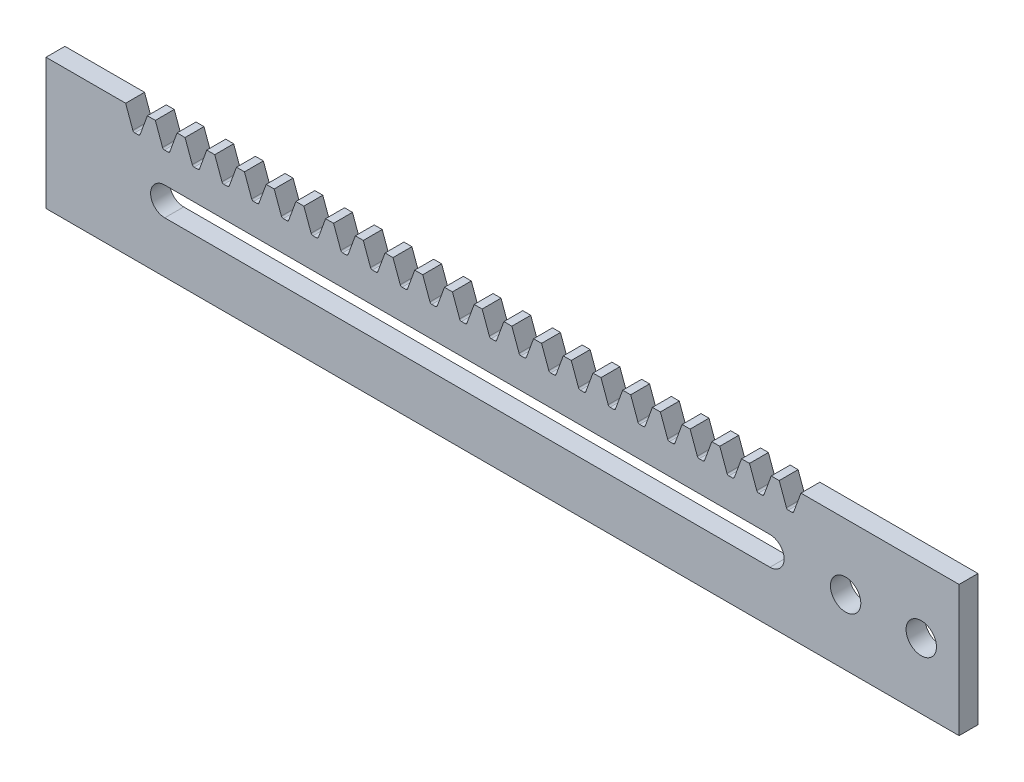
from build123d import *

# Parameters (mm, degrees)
SKETCH1_W              = 609.6
SKETCH1_H              = 19.05
BOSS_EXTRUDE1_DEPTH    = 9.525
CUT_EXTRUDE1_DEPTH     = 19.05
FILLET3_R              = 0.320981709
LPATTERN4_START        = -9.525
LPATTERN4_DEPTH        = 19.05
SKETCH3_W              = 38.983944938
SKETCH3_H              = 30.803159919
CUT_EXTRUDE2_DEPTH     = 381
SKETCH4_W              = 254.285673571
SKETCH4_H              = 51.900357991
CUT_EXTRUDE3_DEPTH     = 15.875
SKETCH5_W              = 228.6
SKETCH5_H              = 3.175
BOSS_EXTRUDE2_DEPTH    = 2.9464
SKETCH8_W              = 113.410729753
SKETCH8_H              = 25.4
CUT_EXTRUDE4_DEPTH     = 306.071559545
SKETCH9_W              = 3.175
SKETCH9_H              = 21.9964
BOSS_EXTRUDE3_DEPTH    = 12.7
SKETCH10_W             = 3.175
SKETCH10_H             = 21.9964
BOSS_EXTRUDE4_DEPTH    = 25.4
F_10_CLEARANCE_HOLE1_D = 5.1054
CUT_EXTRUDE5_DEPTH     = 12.7


with BuildPart() as part:
    # Sketch1 → Boss-Extrude1 (new, symmetric)
    with BuildSketch(Plane.XY):
        Rectangle(SKETCH1_W, SKETCH1_H)
    extrude(amount=BOSS_EXTRUDE1_DEPTH, both=True)

    # Sketch2 → Cut-Extrude1 (cut)
    with BuildSketch(Plane.XY.offset(9.525)):
        Polygon((-303.461960494, 9.525), (-302.172304763, 5.9817), (-301.102365731, 5.9817), (-299.81271, 9.525), align=None)
    extrude(amount=-CUT_EXTRUDE1_DEPTH, mode=Mode.SUBTRACT)

    # Fillet3
    fillet3_edges = [part.edges().sort_by_distance(p)[0] for p in [
        (-301.102365731, 5.9817, 0),
        (-302.172304763, 5.9817, 0),
    ]]
    fillet(fillet3_edges, radius=FILLET3_R)

    # LPattern4: read off the stored shape, not the designer's step
    # LPattern4 outline → LPattern4 (cut)
    with BuildSketch(Plane.XY.offset(LPATTERN4_START)):
        with BuildLine():
            ThreePointArc((-297.261885094, 6.192899499), (-297.144368495, 6.039748886), (-296.96026095, 5.9817))
            Line((-296.96026095, 5.9817), (-296.339829544, 5.9817))
            ThreePointArc((-296.339829544, 5.9817), (-296.155721999, 6.039748886), (-296.0382054, 6.192899499))
            Line((-296.0382054, 6.192899499), (-294.82542, 9.525))
            Line((-294.82542, 9.525), (-298.474670494, 9.525))
            Line((-298.474670494, 9.525), (-297.261885094, 6.192899499))
        make_face()
        with BuildLine():
            Line((303.64938, 9.525), (300.000129506, 9.525))
            Line((300.000129506, 9.525), (301.212914906, 6.192899499))
            ThreePointArc((301.212914906, 6.192899499), (301.330431505, 6.039748886), (301.51453905, 5.9817))
            Line((301.51453905, 5.9817), (302.134970456, 5.9817))
            ThreePointArc((302.134970456, 5.9817), (302.319078001, 6.039748886), (302.4365946, 6.192899499))
            Line((302.4365946, 6.192899499), (303.64938, 9.525))
        make_face()
        with BuildLine():
            Line((298.66209, 9.525), (295.012839506, 9.525))
            Line((295.012839506, 9.525), (296.225624906, 6.192899499))
            ThreePointArc((296.225624906, 6.192899499), (296.343141505, 6.039748886), (296.52724905, 5.9817))
            Line((296.52724905, 5.9817), (297.147680456, 5.9817))
            ThreePointArc((297.147680456, 5.9817), (297.331788001, 6.039748886), (297.4493046, 6.192899499))
            Line((297.4493046, 6.192899499), (298.66209, 9.525))
        make_face()
        with BuildLine():
            Line((293.6748, 9.525), (290.025549506, 9.525))
            Line((290.025549506, 9.525), (291.238334906, 6.192899499))
            ThreePointArc((291.238334906, 6.192899499), (291.355851505, 6.039748886), (291.53995905, 5.9817))
            Line((291.53995905, 5.9817), (292.160390456, 5.9817))
            ThreePointArc((292.160390456, 5.9817), (292.344498001, 6.039748886), (292.4620146, 6.192899499))
            Line((292.4620146, 6.192899499), (293.6748, 9.525))
        make_face()
        with BuildLine():
            Line((288.68751, 9.525), (285.038259506, 9.525))
            Line((285.038259506, 9.525), (286.251044906, 6.192899499))
            ThreePointArc((286.251044906, 6.192899499), (286.368561505, 6.039748886), (286.55266905, 5.9817))
            Line((286.55266905, 5.9817), (287.173100456, 5.9817))
            ThreePointArc((287.173100456, 5.9817), (287.357208001, 6.039748886), (287.4747246, 6.192899499))
            Line((287.4747246, 6.192899499), (288.68751, 9.525))
        make_face()
        with BuildLine():
            Line((283.70022, 9.525), (280.050969506, 9.525))
            Line((280.050969506, 9.525), (281.263754906, 6.192899499))
            ThreePointArc((281.263754906, 6.192899499), (281.381271505, 6.039748886), (281.56537905, 5.9817))
            Line((281.56537905, 5.9817), (282.185810456, 5.9817))
            ThreePointArc((282.185810456, 5.9817), (282.369918001, 6.039748886), (282.4874346, 6.192899499))
            Line((282.4874346, 6.192899499), (283.70022, 9.525))
        make_face()
        with BuildLine():
            Line((278.71293, 9.525), (275.063679506, 9.525))
            Line((275.063679506, 9.525), (276.276464906, 6.192899499))
            ThreePointArc((276.276464906, 6.192899499), (276.393981505, 6.039748886), (276.57808905, 5.9817))
            Line((276.57808905, 5.9817), (277.198520456, 5.9817))
            ThreePointArc((277.198520456, 5.9817), (277.382628001, 6.039748886), (277.5001446, 6.192899499))
            Line((277.5001446, 6.192899499), (278.71293, 9.525))
        make_face()
        with BuildLine():
            Line((273.72564, 9.525), (270.076389506, 9.525))
            Line((270.076389506, 9.525), (271.289174906, 6.192899499))
            ThreePointArc((271.289174906, 6.192899499), (271.406691505, 6.039748886), (271.59079905, 5.9817))
            Line((271.59079905, 5.9817), (272.211230456, 5.9817))
            ThreePointArc((272.211230456, 5.9817), (272.395338001, 6.039748886), (272.5128546, 6.192899499))
            Line((272.5128546, 6.192899499), (273.72564, 9.525))
        make_face()
        with BuildLine():
            Line((268.73835, 9.525), (265.089099506, 9.525))
            Line((265.089099506, 9.525), (266.301884906, 6.192899499))
            ThreePointArc((266.301884906, 6.192899499), (266.419401505, 6.039748886), (266.60350905, 5.9817))
            Line((266.60350905, 5.9817), (267.223940456, 5.9817))
            ThreePointArc((267.223940456, 5.9817), (267.408048001, 6.039748886), (267.5255646, 6.192899499))
            Line((267.5255646, 6.192899499), (268.73835, 9.525))
        make_face()
        with BuildLine():
            Line((263.75106, 9.525), (260.101809506, 9.525))
            Line((260.101809506, 9.525), (261.314594906, 6.192899499))
            ThreePointArc((261.314594906, 6.192899499), (261.432111505, 6.039748886), (261.61621905, 5.9817))
            Line((261.61621905, 5.9817), (262.236650456, 5.9817))
            ThreePointArc((262.236650456, 5.9817), (262.420758001, 6.039748886), (262.5382746, 6.192899499))
            Line((262.5382746, 6.192899499), (263.75106, 9.525))
        make_face()
        with BuildLine():
            Line((258.76377, 9.525), (255.114519506, 9.525))
            Line((255.114519506, 9.525), (256.327304906, 6.192899499))
            ThreePointArc((256.327304906, 6.192899499), (256.444821505, 6.039748886), (256.62892905, 5.9817))
            Line((256.62892905, 5.9817), (257.249360456, 5.9817))
            ThreePointArc((257.249360456, 5.9817), (257.433468001, 6.039748886), (257.5509846, 6.192899499))
            Line((257.5509846, 6.192899499), (258.76377, 9.525))
        make_face()
        with BuildLine():
            Line((253.77648, 9.525), (250.127229506, 9.525))
            Line((250.127229506, 9.525), (251.340014906, 6.192899499))
            ThreePointArc((251.340014906, 6.192899499), (251.457531505, 6.039748886), (251.64163905, 5.9817))
            Line((251.64163905, 5.9817), (252.262070456, 5.9817))
            ThreePointArc((252.262070456, 5.9817), (252.446178001, 6.039748886), (252.5636946, 6.192899499))
            Line((252.5636946, 6.192899499), (253.77648, 9.525))
        make_face()
        with BuildLine():
            Line((248.78919, 9.525), (245.139939506, 9.525))
            Line((245.139939506, 9.525), (246.352724906, 6.192899499))
            ThreePointArc((246.352724906, 6.192899499), (246.470241505, 6.039748886), (246.65434905, 5.9817))
            Line((246.65434905, 5.9817), (247.274780456, 5.9817))
            ThreePointArc((247.274780456, 5.9817), (247.458888001, 6.039748886), (247.5764046, 6.192899499))
            Line((247.5764046, 6.192899499), (248.78919, 9.525))
        make_face()
        with BuildLine():
            Line((243.8019, 9.525), (240.152649506, 9.525))
            Line((240.152649506, 9.525), (241.365434906, 6.192899499))
            ThreePointArc((241.365434906, 6.192899499), (241.482951505, 6.039748886), (241.66705905, 5.9817))
            Line((241.66705905, 5.9817), (242.287490456, 5.9817))
            ThreePointArc((242.287490456, 5.9817), (242.471598001, 6.039748886), (242.5891146, 6.192899499))
            Line((242.5891146, 6.192899499), (243.8019, 9.525))
        make_face()
        with BuildLine():
            Line((238.81461, 9.525), (235.165359506, 9.525))
            Line((235.165359506, 9.525), (236.378144906, 6.192899499))
            ThreePointArc((236.378144906, 6.192899499), (236.495661505, 6.039748886), (236.67976905, 5.9817))
            Line((236.67976905, 5.9817), (237.300200456, 5.9817))
            ThreePointArc((237.300200456, 5.9817), (237.484308001, 6.039748886), (237.6018246, 6.192899499))
            Line((237.6018246, 6.192899499), (238.81461, 9.525))
        make_face()
        with BuildLine():
            Line((233.82732, 9.525), (230.178069506, 9.525))
            Line((230.178069506, 9.525), (231.390854906, 6.192899499))
            ThreePointArc((231.390854906, 6.192899499), (231.508371505, 6.039748886), (231.69247905, 5.9817))
            Line((231.69247905, 5.9817), (232.312910456, 5.9817))
            ThreePointArc((232.312910456, 5.9817), (232.497018001, 6.039748886), (232.6145346, 6.192899499))
            Line((232.6145346, 6.192899499), (233.82732, 9.525))
        make_face()
        with BuildLine():
            Line((228.84003, 9.525), (225.190779506, 9.525))
            Line((225.190779506, 9.525), (226.403564906, 6.192899499))
            ThreePointArc((226.403564906, 6.192899499), (226.521081505, 6.039748886), (226.70518905, 5.9817))
            Line((226.70518905, 5.9817), (227.325620456, 5.9817))
            ThreePointArc((227.325620456, 5.9817), (227.509728001, 6.039748886), (227.6272446, 6.192899499))
            Line((227.6272446, 6.192899499), (228.84003, 9.525))
        make_face()
        with BuildLine():
            Line((223.85274, 9.525), (220.203489506, 9.525))
            Line((220.203489506, 9.525), (221.416274906, 6.192899499))
            ThreePointArc((221.416274906, 6.192899499), (221.533791505, 6.039748886), (221.71789905, 5.9817))
            Line((221.71789905, 5.9817), (222.338330456, 5.9817))
            ThreePointArc((222.338330456, 5.9817), (222.522438001, 6.039748886), (222.6399546, 6.192899499))
            Line((222.6399546, 6.192899499), (223.85274, 9.525))
        make_face()
        with BuildLine():
            Line((218.86545, 9.525), (215.216199506, 9.525))
            Line((215.216199506, 9.525), (216.428984906, 6.192899499))
            ThreePointArc((216.428984906, 6.192899499), (216.546501505, 6.039748886), (216.73060905, 5.9817))
            Line((216.73060905, 5.9817), (217.351040456, 5.9817))
            ThreePointArc((217.351040456, 5.9817), (217.535148001, 6.039748886), (217.6526646, 6.192899499))
            Line((217.6526646, 6.192899499), (218.86545, 9.525))
        make_face()
        with BuildLine():
            Line((213.87816, 9.525), (210.228909506, 9.525))
            Line((210.228909506, 9.525), (211.441694906, 6.192899499))
            ThreePointArc((211.441694906, 6.192899499), (211.559211505, 6.039748886), (211.74331905, 5.9817))
            Line((211.74331905, 5.9817), (212.363750456, 5.9817))
            ThreePointArc((212.363750456, 5.9817), (212.547858001, 6.039748886), (212.6653746, 6.192899499))
            Line((212.6653746, 6.192899499), (213.87816, 9.525))
        make_face()
        with BuildLine():
            Line((208.89087, 9.525), (205.241619506, 9.525))
            Line((205.241619506, 9.525), (206.454404906, 6.192899499))
            ThreePointArc((206.454404906, 6.192899499), (206.571921505, 6.039748886), (206.75602905, 5.9817))
            Line((206.75602905, 5.9817), (207.376460456, 5.9817))
            ThreePointArc((207.376460456, 5.9817), (207.560568001, 6.039748886), (207.6780846, 6.192899499))
            Line((207.6780846, 6.192899499), (208.89087, 9.525))
        make_face()
        with BuildLine():
            Line((203.90358, 9.525), (200.254329506, 9.525))
            Line((200.254329506, 9.525), (201.467114906, 6.192899499))
            ThreePointArc((201.467114906, 6.192899499), (201.584631505, 6.039748886), (201.76873905, 5.9817))
            Line((201.76873905, 5.9817), (202.389170456, 5.9817))
            ThreePointArc((202.389170456, 5.9817), (202.573278001, 6.039748886), (202.6907946, 6.192899499))
            Line((202.6907946, 6.192899499), (203.90358, 9.525))
        make_face()
        with BuildLine():
            Line((198.91629, 9.525), (195.267039506, 9.525))
            Line((195.267039506, 9.525), (196.479824906, 6.192899499))
            ThreePointArc((196.479824906, 6.192899499), (196.597341505, 6.039748886), (196.78144905, 5.9817))
            Line((196.78144905, 5.9817), (197.401880456, 5.9817))
            ThreePointArc((197.401880456, 5.9817), (197.585988001, 6.039748886), (197.7035046, 6.192899499))
            Line((197.7035046, 6.192899499), (198.91629, 9.525))
        make_face()
        with BuildLine():
            Line((193.929, 9.525), (190.279749506, 9.525))
            Line((190.279749506, 9.525), (191.492534906, 6.192899499))
            ThreePointArc((191.492534906, 6.192899499), (191.610051505, 6.039748886), (191.79415905, 5.9817))
            Line((191.79415905, 5.9817), (192.414590456, 5.9817))
            ThreePointArc((192.414590456, 5.9817), (192.598698001, 6.039748886), (192.7162146, 6.192899499))
            Line((192.7162146, 6.192899499), (193.929, 9.525))
        make_face()
        with BuildLine():
            Line((188.94171, 9.525), (185.292459506, 9.525))
            Line((185.292459506, 9.525), (186.505244906, 6.192899499))
            ThreePointArc((186.505244906, 6.192899499), (186.622761505, 6.039748886), (186.80686905, 5.9817))
            Line((186.80686905, 5.9817), (187.427300456, 5.9817))
            ThreePointArc((187.427300456, 5.9817), (187.611408001, 6.039748886), (187.7289246, 6.192899499))
            Line((187.7289246, 6.192899499), (188.94171, 9.525))
        make_face()
        with BuildLine():
            Line((183.95442, 9.525), (180.305169506, 9.525))
            Line((180.305169506, 9.525), (181.517954906, 6.192899499))
            ThreePointArc((181.517954906, 6.192899499), (181.635471505, 6.039748886), (181.81957905, 5.9817))
            Line((181.81957905, 5.9817), (182.440010456, 5.9817))
            ThreePointArc((182.440010456, 5.9817), (182.624118001, 6.039748886), (182.7416346, 6.192899499))
            Line((182.7416346, 6.192899499), (183.95442, 9.525))
        make_face()
        with BuildLine():
            Line((178.96713, 9.525), (175.317879506, 9.525))
            Line((175.317879506, 9.525), (176.530664906, 6.192899499))
            ThreePointArc((176.530664906, 6.192899499), (176.648181505, 6.039748886), (176.83228905, 5.9817))
            Line((176.83228905, 5.9817), (177.452720456, 5.9817))
            ThreePointArc((177.452720456, 5.9817), (177.636828001, 6.039748886), (177.7543446, 6.192899499))
            Line((177.7543446, 6.192899499), (178.96713, 9.525))
        make_face()
        with BuildLine():
            Line((173.97984, 9.525), (170.330589506, 9.525))
            Line((170.330589506, 9.525), (171.543374906, 6.192899499))
            ThreePointArc((171.543374906, 6.192899499), (171.660891505, 6.039748886), (171.84499905, 5.9817))
            Line((171.84499905, 5.9817), (172.465430456, 5.9817))
            ThreePointArc((172.465430456, 5.9817), (172.649538001, 6.039748886), (172.7670546, 6.192899499))
            Line((172.7670546, 6.192899499), (173.97984, 9.525))
        make_face()
        with BuildLine():
            Line((168.99255, 9.525), (165.343299506, 9.525))
            Line((165.343299506, 9.525), (166.556084906, 6.192899499))
            ThreePointArc((166.556084906, 6.192899499), (166.673601505, 6.039748886), (166.85770905, 5.9817))
            Line((166.85770905, 5.9817), (167.478140456, 5.9817))
            ThreePointArc((167.478140456, 5.9817), (167.662248001, 6.039748886), (167.7797646, 6.192899499))
            Line((167.7797646, 6.192899499), (168.99255, 9.525))
        make_face()
        with BuildLine():
            Line((164.00526, 9.525), (160.356009506, 9.525))
            Line((160.356009506, 9.525), (161.568794906, 6.192899499))
            ThreePointArc((161.568794906, 6.192899499), (161.686311505, 6.039748886), (161.87041905, 5.9817))
            Line((161.87041905, 5.9817), (162.490850456, 5.9817))
            ThreePointArc((162.490850456, 5.9817), (162.674958001, 6.039748886), (162.7924746, 6.192899499))
            Line((162.7924746, 6.192899499), (164.00526, 9.525))
        make_face()
        with BuildLine():
            Line((159.01797, 9.525), (155.368719506, 9.525))
            Line((155.368719506, 9.525), (156.581504906, 6.192899499))
            ThreePointArc((156.581504906, 6.192899499), (156.699021505, 6.039748886), (156.88312905, 5.9817))
            Line((156.88312905, 5.9817), (157.503560456, 5.9817))
            ThreePointArc((157.503560456, 5.9817), (157.687668001, 6.039748886), (157.8051846, 6.192899499))
            Line((157.8051846, 6.192899499), (159.01797, 9.525))
        make_face()
        with BuildLine():
            Line((154.03068, 9.525), (150.381429506, 9.525))
            Line((150.381429506, 9.525), (151.594214906, 6.192899499))
            ThreePointArc((151.594214906, 6.192899499), (151.711731505, 6.039748886), (151.89583905, 5.9817))
            Line((151.89583905, 5.9817), (152.516270456, 5.9817))
            ThreePointArc((152.516270456, 5.9817), (152.700378001, 6.039748886), (152.8178946, 6.192899499))
            Line((152.8178946, 6.192899499), (154.03068, 9.525))
        make_face()
        with BuildLine():
            Line((149.04339, 9.525), (145.394139506, 9.525))
            Line((145.394139506, 9.525), (146.606924906, 6.192899499))
            ThreePointArc((146.606924906, 6.192899499), (146.724441505, 6.039748886), (146.90854905, 5.9817))
            Line((146.90854905, 5.9817), (147.528980456, 5.9817))
            ThreePointArc((147.528980456, 5.9817), (147.713088001, 6.039748886), (147.8306046, 6.192899499))
            Line((147.8306046, 6.192899499), (149.04339, 9.525))
        make_face()
        with BuildLine():
            Line((144.0561, 9.525), (140.406849506, 9.525))
            Line((140.406849506, 9.525), (141.619634906, 6.192899499))
            ThreePointArc((141.619634906, 6.192899499), (141.737151505, 6.039748886), (141.92125905, 5.9817))
            Line((141.92125905, 5.9817), (142.541690456, 5.9817))
            ThreePointArc((142.541690456, 5.9817), (142.725798001, 6.039748886), (142.8433146, 6.192899499))
            Line((142.8433146, 6.192899499), (144.0561, 9.525))
        make_face()
        with BuildLine():
            Line((139.06881, 9.525), (135.419559506, 9.525))
            Line((135.419559506, 9.525), (136.632344906, 6.192899499))
            ThreePointArc((136.632344906, 6.192899499), (136.749861505, 6.039748886), (136.93396905, 5.9817))
            Line((136.93396905, 5.9817), (137.554400456, 5.9817))
            ThreePointArc((137.554400456, 5.9817), (137.738508001, 6.039748886), (137.8560246, 6.192899499))
            Line((137.8560246, 6.192899499), (139.06881, 9.525))
        make_face()
        with BuildLine():
            Line((134.08152, 9.525), (130.432269506, 9.525))
            Line((130.432269506, 9.525), (131.645054906, 6.192899499))
            ThreePointArc((131.645054906, 6.192899499), (131.762571505, 6.039748886), (131.94667905, 5.9817))
            Line((131.94667905, 5.9817), (132.567110456, 5.9817))
            ThreePointArc((132.567110456, 5.9817), (132.751218001, 6.039748886), (132.8687346, 6.192899499))
            Line((132.8687346, 6.192899499), (134.08152, 9.525))
        make_face()
        with BuildLine():
            Line((129.09423, 9.525), (125.444979506, 9.525))
            Line((125.444979506, 9.525), (126.657764906, 6.192899499))
            ThreePointArc((126.657764906, 6.192899499), (126.775281505, 6.039748886), (126.95938905, 5.9817))
            Line((126.95938905, 5.9817), (127.579820456, 5.9817))
            ThreePointArc((127.579820456, 5.9817), (127.763928001, 6.039748886), (127.8814446, 6.192899499))
            Line((127.8814446, 6.192899499), (129.09423, 9.525))
        make_face()
        with BuildLine():
            Line((124.10694, 9.525), (120.457689506, 9.525))
            Line((120.457689506, 9.525), (121.670474906, 6.192899499))
            ThreePointArc((121.670474906, 6.192899499), (121.787991505, 6.039748886), (121.97209905, 5.9817))
            Line((121.97209905, 5.9817), (122.592530456, 5.9817))
            ThreePointArc((122.592530456, 5.9817), (122.776638001, 6.039748886), (122.8941546, 6.192899499))
            Line((122.8941546, 6.192899499), (124.10694, 9.525))
        make_face()
        with BuildLine():
            Line((119.11965, 9.525), (115.470399506, 9.525))
            Line((115.470399506, 9.525), (116.683184906, 6.192899499))
            ThreePointArc((116.683184906, 6.192899499), (116.800701505, 6.039748886), (116.98480905, 5.9817))
            Line((116.98480905, 5.9817), (117.605240456, 5.9817))
            ThreePointArc((117.605240456, 5.9817), (117.789348001, 6.039748886), (117.9068646, 6.192899499))
            Line((117.9068646, 6.192899499), (119.11965, 9.525))
        make_face()
        with BuildLine():
            Line((114.13236, 9.525), (110.483109506, 9.525))
            Line((110.483109506, 9.525), (111.695894906, 6.192899499))
            ThreePointArc((111.695894906, 6.192899499), (111.813411505, 6.039748886), (111.99751905, 5.9817))
            Line((111.99751905, 5.9817), (112.617950456, 5.9817))
            ThreePointArc((112.617950456, 5.9817), (112.802058001, 6.039748886), (112.9195746, 6.192899499))
            Line((112.9195746, 6.192899499), (114.13236, 9.525))
        make_face()
        with BuildLine():
            Line((109.14507, 9.525), (105.495819506, 9.525))
            Line((105.495819506, 9.525), (106.708604906, 6.192899499))
            ThreePointArc((106.708604906, 6.192899499), (106.826121505, 6.039748886), (107.01022905, 5.9817))
            Line((107.01022905, 5.9817), (107.630660456, 5.9817))
            ThreePointArc((107.630660456, 5.9817), (107.814768001, 6.039748886), (107.9322846, 6.192899499))
            Line((107.9322846, 6.192899499), (109.14507, 9.525))
        make_face()
        with BuildLine():
            Line((104.15778, 9.525), (100.508529506, 9.525))
            Line((100.508529506, 9.525), (101.721314906, 6.192899499))
            ThreePointArc((101.721314906, 6.192899499), (101.838831505, 6.039748886), (102.02293905, 5.9817))
            Line((102.02293905, 5.9817), (102.643370456, 5.9817))
            ThreePointArc((102.643370456, 5.9817), (102.827478001, 6.039748886), (102.9449946, 6.192899499))
            Line((102.9449946, 6.192899499), (104.15778, 9.525))
        make_face()
        with BuildLine():
            Line((99.17049, 9.525), (95.521239506, 9.525))
            Line((95.521239506, 9.525), (96.734024906, 6.192899499))
            ThreePointArc((96.734024906, 6.192899499), (96.851541505, 6.039748886), (97.03564905, 5.9817))
            Line((97.03564905, 5.9817), (97.656080456, 5.9817))
            ThreePointArc((97.656080456, 5.9817), (97.840188001, 6.039748886), (97.9577046, 6.192899499))
            Line((97.9577046, 6.192899499), (99.17049, 9.525))
        make_face()
        with BuildLine():
            Line((94.1832, 9.525), (90.533949506, 9.525))
            Line((90.533949506, 9.525), (91.746734906, 6.192899499))
            ThreePointArc((91.746734906, 6.192899499), (91.864251505, 6.039748886), (92.04835905, 5.9817))
            Line((92.04835905, 5.9817), (92.668790456, 5.9817))
            ThreePointArc((92.668790456, 5.9817), (92.852898001, 6.039748886), (92.9704146, 6.192899499))
            Line((92.9704146, 6.192899499), (94.1832, 9.525))
        make_face()
        with BuildLine():
            Line((89.19591, 9.525), (85.546659506, 9.525))
            Line((85.546659506, 9.525), (86.759444906, 6.192899499))
            ThreePointArc((86.759444906, 6.192899499), (86.876961505, 6.039748886), (87.06106905, 5.9817))
            Line((87.06106905, 5.9817), (87.681500456, 5.9817))
            ThreePointArc((87.681500456, 5.9817), (87.865608001, 6.039748886), (87.9831246, 6.192899499))
            Line((87.9831246, 6.192899499), (89.19591, 9.525))
        make_face()
        with BuildLine():
            Line((84.20862, 9.525), (80.559369506, 9.525))
            Line((80.559369506, 9.525), (81.772154906, 6.192899499))
            ThreePointArc((81.772154906, 6.192899499), (81.889671505, 6.039748886), (82.07377905, 5.9817))
            Line((82.07377905, 5.9817), (82.694210456, 5.9817))
            ThreePointArc((82.694210456, 5.9817), (82.878318001, 6.039748886), (82.9958346, 6.192899499))
            Line((82.9958346, 6.192899499), (84.20862, 9.525))
        make_face()
        with BuildLine():
            Line((79.22133, 9.525), (75.572079506, 9.525))
            Line((75.572079506, 9.525), (76.784864906, 6.192899499))
            ThreePointArc((76.784864906, 6.192899499), (76.902381505, 6.039748886), (77.08648905, 5.9817))
            Line((77.08648905, 5.9817), (77.706920456, 5.9817))
            ThreePointArc((77.706920456, 5.9817), (77.891028001, 6.039748886), (78.0085446, 6.192899499))
            Line((78.0085446, 6.192899499), (79.22133, 9.525))
        make_face()
        with BuildLine():
            Line((74.23404, 9.525), (70.584789506, 9.525))
            Line((70.584789506, 9.525), (71.797574906, 6.192899499))
            ThreePointArc((71.797574906, 6.192899499), (71.915091505, 6.039748886), (72.09919905, 5.9817))
            Line((72.09919905, 5.9817), (72.719630456, 5.9817))
            ThreePointArc((72.719630456, 5.9817), (72.903738001, 6.039748886), (73.0212546, 6.192899499))
            Line((73.0212546, 6.192899499), (74.23404, 9.525))
        make_face()
        with BuildLine():
            Line((69.24675, 9.525), (65.597499506, 9.525))
            Line((65.597499506, 9.525), (66.810284906, 6.192899499))
            ThreePointArc((66.810284906, 6.192899499), (66.927801505, 6.039748886), (67.11190905, 5.9817))
            Line((67.11190905, 5.9817), (67.732340456, 5.9817))
            ThreePointArc((67.732340456, 5.9817), (67.916448001, 6.039748886), (68.0339646, 6.192899499))
            Line((68.0339646, 6.192899499), (69.24675, 9.525))
        make_face()
        with BuildLine():
            Line((64.25946, 9.525), (60.610209506, 9.525))
            Line((60.610209506, 9.525), (61.822994906, 6.192899499))
            ThreePointArc((61.822994906, 6.192899499), (61.940511505, 6.039748886), (62.12461905, 5.9817))
            Line((62.12461905, 5.9817), (62.745050456, 5.9817))
            ThreePointArc((62.745050456, 5.9817), (62.929158001, 6.039748886), (63.0466746, 6.192899499))
            Line((63.0466746, 6.192899499), (64.25946, 9.525))
        make_face()
        with BuildLine():
            Line((59.27217, 9.525), (55.622919506, 9.525))
            Line((55.622919506, 9.525), (56.835704906, 6.192899499))
            ThreePointArc((56.835704906, 6.192899499), (56.953221505, 6.039748886), (57.13732905, 5.9817))
            Line((57.13732905, 5.9817), (57.757760456, 5.9817))
            ThreePointArc((57.757760456, 5.9817), (57.941868001, 6.039748886), (58.0593846, 6.192899499))
            Line((58.0593846, 6.192899499), (59.27217, 9.525))
        make_face()
        with BuildLine():
            Line((54.28488, 9.525), (50.635629506, 9.525))
            Line((50.635629506, 9.525), (51.848414906, 6.192899499))
            ThreePointArc((51.848414906, 6.192899499), (51.965931505, 6.039748886), (52.15003905, 5.9817))
            Line((52.15003905, 5.9817), (52.770470456, 5.9817))
            ThreePointArc((52.770470456, 5.9817), (52.954578001, 6.039748886), (53.0720946, 6.192899499))
            Line((53.0720946, 6.192899499), (54.28488, 9.525))
        make_face()
        with BuildLine():
            Line((49.29759, 9.525), (45.648339506, 9.525))
            Line((45.648339506, 9.525), (46.861124906, 6.192899499))
            ThreePointArc((46.861124906, 6.192899499), (46.978641505, 6.039748886), (47.16274905, 5.9817))
            Line((47.16274905, 5.9817), (47.783180456, 5.9817))
            ThreePointArc((47.783180456, 5.9817), (47.967288001, 6.039748886), (48.0848046, 6.192899499))
            Line((48.0848046, 6.192899499), (49.29759, 9.525))
        make_face()
        with BuildLine():
            Line((44.3103, 9.525), (40.661049506, 9.525))
            Line((40.661049506, 9.525), (41.873834906, 6.192899499))
            ThreePointArc((41.873834906, 6.192899499), (41.991351505, 6.039748886), (42.17545905, 5.9817))
            Line((42.17545905, 5.9817), (42.795890456, 5.9817))
            ThreePointArc((42.795890456, 5.9817), (42.979998001, 6.039748886), (43.0975146, 6.192899499))
            Line((43.0975146, 6.192899499), (44.3103, 9.525))
        make_face()
        with BuildLine():
            Line((39.32301, 9.525), (35.673759506, 9.525))
            Line((35.673759506, 9.525), (36.886544906, 6.192899499))
            ThreePointArc((36.886544906, 6.192899499), (37.004061505, 6.039748886), (37.18816905, 5.9817))
            Line((37.18816905, 5.9817), (37.808600456, 5.9817))
            ThreePointArc((37.808600456, 5.9817), (37.992708001, 6.039748886), (38.1102246, 6.192899499))
            Line((38.1102246, 6.192899499), (39.32301, 9.525))
        make_face()
        with BuildLine():
            Line((34.33572, 9.525), (30.686469506, 9.525))
            Line((30.686469506, 9.525), (31.899254906, 6.192899499))
            ThreePointArc((31.899254906, 6.192899499), (32.016771505, 6.039748886), (32.20087905, 5.9817))
            Line((32.20087905, 5.9817), (32.821310456, 5.9817))
            ThreePointArc((32.821310456, 5.9817), (33.005418001, 6.039748886), (33.1229346, 6.192899499))
            Line((33.1229346, 6.192899499), (34.33572, 9.525))
        make_face()
        with BuildLine():
            Line((29.34843, 9.525), (25.699179506, 9.525))
            Line((25.699179506, 9.525), (26.911964906, 6.192899499))
            ThreePointArc((26.911964906, 6.192899499), (27.029481505, 6.039748886), (27.21358905, 5.9817))
            Line((27.21358905, 5.9817), (27.834020456, 5.9817))
            ThreePointArc((27.834020456, 5.9817), (28.018128001, 6.039748886), (28.1356446, 6.192899499))
            Line((28.1356446, 6.192899499), (29.34843, 9.525))
        make_face()
        with BuildLine():
            Line((24.36114, 9.525), (20.711889506, 9.525))
            Line((20.711889506, 9.525), (21.924674906, 6.192899499))
            ThreePointArc((21.924674906, 6.192899499), (22.042191505, 6.039748886), (22.22629905, 5.9817))
            Line((22.22629905, 5.9817), (22.846730456, 5.9817))
            ThreePointArc((22.846730456, 5.9817), (23.030838001, 6.039748886), (23.1483546, 6.192899499))
            Line((23.1483546, 6.192899499), (24.36114, 9.525))
        make_face()
        with BuildLine():
            Line((19.37385, 9.525), (15.724599506, 9.525))
            Line((15.724599506, 9.525), (16.937384906, 6.192899499))
            ThreePointArc((16.937384906, 6.192899499), (17.054901505, 6.039748886), (17.23900905, 5.9817))
            Line((17.23900905, 5.9817), (17.859440456, 5.9817))
            ThreePointArc((17.859440456, 5.9817), (18.043548001, 6.039748886), (18.1610646, 6.192899499))
            Line((18.1610646, 6.192899499), (19.37385, 9.525))
        make_face()
        with BuildLine():
            Line((14.38656, 9.525), (10.737309506, 9.525))
            Line((10.737309506, 9.525), (11.950094906, 6.192899499))
            ThreePointArc((11.950094906, 6.192899499), (12.067611505, 6.039748886), (12.25171905, 5.9817))
            Line((12.25171905, 5.9817), (12.872150456, 5.9817))
            ThreePointArc((12.872150456, 5.9817), (13.056258001, 6.039748886), (13.1737746, 6.192899499))
            Line((13.1737746, 6.192899499), (14.38656, 9.525))
        make_face()
        with BuildLine():
            Line((9.39927, 9.525), (5.750019506, 9.525))
            Line((5.750019506, 9.525), (6.962804906, 6.192899499))
            ThreePointArc((6.962804906, 6.192899499), (7.080321505, 6.039748886), (7.26442905, 5.9817))
            Line((7.26442905, 5.9817), (7.884860456, 5.9817))
            ThreePointArc((7.884860456, 5.9817), (8.068968001, 6.039748886), (8.1864846, 6.192899499))
            Line((8.1864846, 6.192899499), (9.39927, 9.525))
        make_face()
        with BuildLine():
            Line((4.41198, 9.525), (0.762729506, 9.525))
            Line((0.762729506, 9.525), (1.975514906, 6.192899499))
            ThreePointArc((1.975514906, 6.192899499), (2.093031505, 6.039748886), (2.27713905, 5.9817))
            Line((2.27713905, 5.9817), (2.897570456, 5.9817))
            ThreePointArc((2.897570456, 5.9817), (3.081678001, 6.039748886), (3.1991946, 6.192899499))
            Line((3.1991946, 6.192899499), (4.41198, 9.525))
        make_face()
        with BuildLine():
            Line((-0.57531, 9.525), (-4.224560494, 9.525))
            Line((-4.224560494, 9.525), (-3.011775094, 6.192899499))
            ThreePointArc((-3.011775094, 6.192899499), (-2.894258495, 6.039748886), (-2.71015095, 5.9817))
            Line((-2.71015095, 5.9817), (-2.089719544, 5.9817))
            ThreePointArc((-2.089719544, 5.9817), (-1.905611999, 6.039748886), (-1.7880954, 6.192899499))
            Line((-1.7880954, 6.192899499), (-0.57531, 9.525))
        make_face()
        with BuildLine():
            Line((-5.5626, 9.525), (-9.211850494, 9.525))
            Line((-9.211850494, 9.525), (-7.999065094, 6.192899499))
            ThreePointArc((-7.999065094, 6.192899499), (-7.881548495, 6.039748886), (-7.69744095, 5.9817))
            Line((-7.69744095, 5.9817), (-7.077009544, 5.9817))
            ThreePointArc((-7.077009544, 5.9817), (-6.892901999, 6.039748886), (-6.7753854, 6.192899499))
            Line((-6.7753854, 6.192899499), (-5.5626, 9.525))
        make_face()
        with BuildLine():
            Line((-10.54989, 9.525), (-14.199140494, 9.525))
            Line((-14.199140494, 9.525), (-12.986355094, 6.192899499))
            ThreePointArc((-12.986355094, 6.192899499), (-12.868838495, 6.039748886), (-12.68473095, 5.9817))
            Line((-12.68473095, 5.9817), (-12.064299544, 5.9817))
            ThreePointArc((-12.064299544, 5.9817), (-11.880191999, 6.039748886), (-11.7626754, 6.192899499))
            Line((-11.7626754, 6.192899499), (-10.54989, 9.525))
        make_face()
        with BuildLine():
            Line((-15.53718, 9.525), (-19.186430494, 9.525))
            Line((-19.186430494, 9.525), (-17.973645094, 6.192899499))
            ThreePointArc((-17.973645094, 6.192899499), (-17.856128495, 6.039748886), (-17.67202095, 5.9817))
            Line((-17.67202095, 5.9817), (-17.051589544, 5.9817))
            ThreePointArc((-17.051589544, 5.9817), (-16.867481999, 6.039748886), (-16.7499654, 6.192899499))
            Line((-16.7499654, 6.192899499), (-15.53718, 9.525))
        make_face()
        with BuildLine():
            Line((-20.52447, 9.525), (-24.173720494, 9.525))
            Line((-24.173720494, 9.525), (-22.960935094, 6.192899499))
            ThreePointArc((-22.960935094, 6.192899499), (-22.843418495, 6.039748886), (-22.65931095, 5.9817))
            Line((-22.65931095, 5.9817), (-22.038879544, 5.9817))
            ThreePointArc((-22.038879544, 5.9817), (-21.854771999, 6.039748886), (-21.7372554, 6.192899499))
            Line((-21.7372554, 6.192899499), (-20.52447, 9.525))
        make_face()
        with BuildLine():
            Line((-25.51176, 9.525), (-29.161010494, 9.525))
            Line((-29.161010494, 9.525), (-27.948225094, 6.192899499))
            ThreePointArc((-27.948225094, 6.192899499), (-27.830708495, 6.039748886), (-27.64660095, 5.9817))
            Line((-27.64660095, 5.9817), (-27.026169544, 5.9817))
            ThreePointArc((-27.026169544, 5.9817), (-26.842061999, 6.039748886), (-26.7245454, 6.192899499))
            Line((-26.7245454, 6.192899499), (-25.51176, 9.525))
        make_face()
        with BuildLine():
            Line((-30.49905, 9.525), (-34.148300494, 9.525))
            Line((-34.148300494, 9.525), (-32.935515094, 6.192899499))
            ThreePointArc((-32.935515094, 6.192899499), (-32.817998495, 6.039748886), (-32.63389095, 5.9817))
            Line((-32.63389095, 5.9817), (-32.013459544, 5.9817))
            ThreePointArc((-32.013459544, 5.9817), (-31.829351999, 6.039748886), (-31.7118354, 6.192899499))
            Line((-31.7118354, 6.192899499), (-30.49905, 9.525))
        make_face()
        with BuildLine():
            Line((-35.48634, 9.525), (-39.135590494, 9.525))
            Line((-39.135590494, 9.525), (-37.922805094, 6.192899499))
            ThreePointArc((-37.922805094, 6.192899499), (-37.805288495, 6.039748886), (-37.62118095, 5.9817))
            Line((-37.62118095, 5.9817), (-37.000749544, 5.9817))
            ThreePointArc((-37.000749544, 5.9817), (-36.816641999, 6.039748886), (-36.6991254, 6.192899499))
            Line((-36.6991254, 6.192899499), (-35.48634, 9.525))
        make_face()
        with BuildLine():
            Line((-40.47363, 9.525), (-44.122880494, 9.525))
            Line((-44.122880494, 9.525), (-42.910095094, 6.192899499))
            ThreePointArc((-42.910095094, 6.192899499), (-42.792578495, 6.039748886), (-42.60847095, 5.9817))
            Line((-42.60847095, 5.9817), (-41.988039544, 5.9817))
            ThreePointArc((-41.988039544, 5.9817), (-41.803931999, 6.039748886), (-41.6864154, 6.192899499))
            Line((-41.6864154, 6.192899499), (-40.47363, 9.525))
        make_face()
        with BuildLine():
            Line((-45.46092, 9.525), (-49.110170494, 9.525))
            Line((-49.110170494, 9.525), (-47.897385094, 6.192899499))
            ThreePointArc((-47.897385094, 6.192899499), (-47.779868495, 6.039748886), (-47.59576095, 5.9817))
            Line((-47.59576095, 5.9817), (-46.975329544, 5.9817))
            ThreePointArc((-46.975329544, 5.9817), (-46.791221999, 6.039748886), (-46.6737054, 6.192899499))
            Line((-46.6737054, 6.192899499), (-45.46092, 9.525))
        make_face()
        with BuildLine():
            Line((-50.44821, 9.525), (-54.097460494, 9.525))
            Line((-54.097460494, 9.525), (-52.884675094, 6.192899499))
            ThreePointArc((-52.884675094, 6.192899499), (-52.767158495, 6.039748886), (-52.58305095, 5.9817))
            Line((-52.58305095, 5.9817), (-51.962619544, 5.9817))
            ThreePointArc((-51.962619544, 5.9817), (-51.778511999, 6.039748886), (-51.6609954, 6.192899499))
            Line((-51.6609954, 6.192899499), (-50.44821, 9.525))
        make_face()
        with BuildLine():
            Line((-55.4355, 9.525), (-59.084750494, 9.525))
            Line((-59.084750494, 9.525), (-57.871965094, 6.192899499))
            ThreePointArc((-57.871965094, 6.192899499), (-57.754448495, 6.039748886), (-57.57034095, 5.9817))
            Line((-57.57034095, 5.9817), (-56.949909544, 5.9817))
            ThreePointArc((-56.949909544, 5.9817), (-56.765801999, 6.039748886), (-56.6482854, 6.192899499))
            Line((-56.6482854, 6.192899499), (-55.4355, 9.525))
        make_face()
        with BuildLine():
            Line((-60.42279, 9.525), (-64.072040494, 9.525))
            Line((-64.072040494, 9.525), (-62.859255094, 6.192899499))
            ThreePointArc((-62.859255094, 6.192899499), (-62.741738495, 6.039748886), (-62.55763095, 5.9817))
            Line((-62.55763095, 5.9817), (-61.937199544, 5.9817))
            ThreePointArc((-61.937199544, 5.9817), (-61.753091999, 6.039748886), (-61.6355754, 6.192899499))
            Line((-61.6355754, 6.192899499), (-60.42279, 9.525))
        make_face()
        with BuildLine():
            Line((-65.41008, 9.525), (-69.059330494, 9.525))
            Line((-69.059330494, 9.525), (-67.846545094, 6.192899499))
            ThreePointArc((-67.846545094, 6.192899499), (-67.729028495, 6.039748886), (-67.54492095, 5.9817))
            Line((-67.54492095, 5.9817), (-66.924489544, 5.9817))
            ThreePointArc((-66.924489544, 5.9817), (-66.740381999, 6.039748886), (-66.6228654, 6.192899499))
            Line((-66.6228654, 6.192899499), (-65.41008, 9.525))
        make_face()
        with BuildLine():
            Line((-70.39737, 9.525), (-74.046620494, 9.525))
            Line((-74.046620494, 9.525), (-72.833835094, 6.192899499))
            ThreePointArc((-72.833835094, 6.192899499), (-72.716318495, 6.039748886), (-72.53221095, 5.9817))
            Line((-72.53221095, 5.9817), (-71.911779544, 5.9817))
            ThreePointArc((-71.911779544, 5.9817), (-71.727671999, 6.039748886), (-71.6101554, 6.192899499))
            Line((-71.6101554, 6.192899499), (-70.39737, 9.525))
        make_face()
        with BuildLine():
            Line((-75.38466, 9.525), (-79.033910494, 9.525))
            Line((-79.033910494, 9.525), (-77.821125094, 6.192899499))
            ThreePointArc((-77.821125094, 6.192899499), (-77.703608495, 6.039748886), (-77.51950095, 5.9817))
            Line((-77.51950095, 5.9817), (-76.899069544, 5.9817))
            ThreePointArc((-76.899069544, 5.9817), (-76.714961999, 6.039748886), (-76.5974454, 6.192899499))
            Line((-76.5974454, 6.192899499), (-75.38466, 9.525))
        make_face()
        with BuildLine():
            Line((-80.37195, 9.525), (-84.021200494, 9.525))
            Line((-84.021200494, 9.525), (-82.808415094, 6.192899499))
            ThreePointArc((-82.808415094, 6.192899499), (-82.690898495, 6.039748886), (-82.50679095, 5.9817))
            Line((-82.50679095, 5.9817), (-81.886359544, 5.9817))
            ThreePointArc((-81.886359544, 5.9817), (-81.702251999, 6.039748886), (-81.5847354, 6.192899499))
            Line((-81.5847354, 6.192899499), (-80.37195, 9.525))
        make_face()
        with BuildLine():
            Line((-85.35924, 9.525), (-89.008490494, 9.525))
            Line((-89.008490494, 9.525), (-87.795705094, 6.192899499))
            ThreePointArc((-87.795705094, 6.192899499), (-87.678188495, 6.039748886), (-87.49408095, 5.9817))
            Line((-87.49408095, 5.9817), (-86.873649544, 5.9817))
            ThreePointArc((-86.873649544, 5.9817), (-86.689541999, 6.039748886), (-86.5720254, 6.192899499))
            Line((-86.5720254, 6.192899499), (-85.35924, 9.525))
        make_face()
        with BuildLine():
            Line((-90.34653, 9.525), (-93.995780494, 9.525))
            Line((-93.995780494, 9.525), (-92.782995094, 6.192899499))
            ThreePointArc((-92.782995094, 6.192899499), (-92.665478495, 6.039748886), (-92.48137095, 5.9817))
            Line((-92.48137095, 5.9817), (-91.860939544, 5.9817))
            ThreePointArc((-91.860939544, 5.9817), (-91.676831999, 6.039748886), (-91.5593154, 6.192899499))
            Line((-91.5593154, 6.192899499), (-90.34653, 9.525))
        make_face()
        with BuildLine():
            Line((-95.33382, 9.525), (-98.983070494, 9.525))
            Line((-98.983070494, 9.525), (-97.770285094, 6.192899499))
            ThreePointArc((-97.770285094, 6.192899499), (-97.652768495, 6.039748886), (-97.46866095, 5.9817))
            Line((-97.46866095, 5.9817), (-96.848229544, 5.9817))
            ThreePointArc((-96.848229544, 5.9817), (-96.664121999, 6.039748886), (-96.5466054, 6.192899499))
            Line((-96.5466054, 6.192899499), (-95.33382, 9.525))
        make_face()
        with BuildLine():
            Line((-100.32111, 9.525), (-103.970360494, 9.525))
            Line((-103.970360494, 9.525), (-102.757575094, 6.192899499))
            ThreePointArc((-102.757575094, 6.192899499), (-102.640058495, 6.039748886), (-102.45595095, 5.9817))
            Line((-102.45595095, 5.9817), (-101.835519544, 5.9817))
            ThreePointArc((-101.835519544, 5.9817), (-101.651411999, 6.039748886), (-101.5338954, 6.192899499))
            Line((-101.5338954, 6.192899499), (-100.32111, 9.525))
        make_face()
        with BuildLine():
            Line((-105.3084, 9.525), (-108.957650494, 9.525))
            Line((-108.957650494, 9.525), (-107.744865094, 6.192899499))
            ThreePointArc((-107.744865094, 6.192899499), (-107.627348495, 6.039748886), (-107.44324095, 5.9817))
            Line((-107.44324095, 5.9817), (-106.822809544, 5.9817))
            ThreePointArc((-106.822809544, 5.9817), (-106.638701999, 6.039748886), (-106.5211854, 6.192899499))
            Line((-106.5211854, 6.192899499), (-105.3084, 9.525))
        make_face()
        with BuildLine():
            Line((-110.29569, 9.525), (-113.944940494, 9.525))
            Line((-113.944940494, 9.525), (-112.732155094, 6.192899499))
            ThreePointArc((-112.732155094, 6.192899499), (-112.614638495, 6.039748886), (-112.43053095, 5.9817))
            Line((-112.43053095, 5.9817), (-111.810099544, 5.9817))
            ThreePointArc((-111.810099544, 5.9817), (-111.625991999, 6.039748886), (-111.5084754, 6.192899499))
            Line((-111.5084754, 6.192899499), (-110.29569, 9.525))
        make_face()
        with BuildLine():
            Line((-115.28298, 9.525), (-118.932230494, 9.525))
            Line((-118.932230494, 9.525), (-117.719445094, 6.192899499))
            ThreePointArc((-117.719445094, 6.192899499), (-117.601928495, 6.039748886), (-117.41782095, 5.9817))
            Line((-117.41782095, 5.9817), (-116.797389544, 5.9817))
            ThreePointArc((-116.797389544, 5.9817), (-116.613281999, 6.039748886), (-116.4957654, 6.192899499))
            Line((-116.4957654, 6.192899499), (-115.28298, 9.525))
        make_face()
        with BuildLine():
            Line((-120.27027, 9.525), (-123.919520494, 9.525))
            Line((-123.919520494, 9.525), (-122.706735094, 6.192899499))
            ThreePointArc((-122.706735094, 6.192899499), (-122.589218495, 6.039748886), (-122.40511095, 5.9817))
            Line((-122.40511095, 5.9817), (-121.784679544, 5.9817))
            ThreePointArc((-121.784679544, 5.9817), (-121.600571999, 6.039748886), (-121.4830554, 6.192899499))
            Line((-121.4830554, 6.192899499), (-120.27027, 9.525))
        make_face()
        with BuildLine():
            Line((-125.25756, 9.525), (-128.906810494, 9.525))
            Line((-128.906810494, 9.525), (-127.694025094, 6.192899499))
            ThreePointArc((-127.694025094, 6.192899499), (-127.576508495, 6.039748886), (-127.39240095, 5.9817))
            Line((-127.39240095, 5.9817), (-126.771969544, 5.9817))
            ThreePointArc((-126.771969544, 5.9817), (-126.587861999, 6.039748886), (-126.4703454, 6.192899499))
            Line((-126.4703454, 6.192899499), (-125.25756, 9.525))
        make_face()
        with BuildLine():
            Line((-130.24485, 9.525), (-133.894100494, 9.525))
            Line((-133.894100494, 9.525), (-132.681315094, 6.192899499))
            ThreePointArc((-132.681315094, 6.192899499), (-132.563798495, 6.039748886), (-132.37969095, 5.9817))
            Line((-132.37969095, 5.9817), (-131.759259544, 5.9817))
            ThreePointArc((-131.759259544, 5.9817), (-131.575151999, 6.039748886), (-131.4576354, 6.192899499))
            Line((-131.4576354, 6.192899499), (-130.24485, 9.525))
        make_face()
        with BuildLine():
            Line((-135.23214, 9.525), (-138.881390494, 9.525))
            Line((-138.881390494, 9.525), (-137.668605094, 6.192899499))
            ThreePointArc((-137.668605094, 6.192899499), (-137.551088495, 6.039748886), (-137.36698095, 5.9817))
            Line((-137.36698095, 5.9817), (-136.746549544, 5.9817))
            ThreePointArc((-136.746549544, 5.9817), (-136.562441999, 6.039748886), (-136.4449254, 6.192899499))
            Line((-136.4449254, 6.192899499), (-135.23214, 9.525))
        make_face()
        with BuildLine():
            Line((-140.21943, 9.525), (-143.868680494, 9.525))
            Line((-143.868680494, 9.525), (-142.655895094, 6.192899499))
            ThreePointArc((-142.655895094, 6.192899499), (-142.538378495, 6.039748886), (-142.35427095, 5.9817))
            Line((-142.35427095, 5.9817), (-141.733839544, 5.9817))
            ThreePointArc((-141.733839544, 5.9817), (-141.549731999, 6.039748886), (-141.4322154, 6.192899499))
            Line((-141.4322154, 6.192899499), (-140.21943, 9.525))
        make_face()
        with BuildLine():
            Line((-145.20672, 9.525), (-148.855970494, 9.525))
            Line((-148.855970494, 9.525), (-147.643185094, 6.192899499))
            ThreePointArc((-147.643185094, 6.192899499), (-147.525668495, 6.039748886), (-147.34156095, 5.9817))
            Line((-147.34156095, 5.9817), (-146.721129544, 5.9817))
            ThreePointArc((-146.721129544, 5.9817), (-146.537021999, 6.039748886), (-146.4195054, 6.192899499))
            Line((-146.4195054, 6.192899499), (-145.20672, 9.525))
        make_face()
        with BuildLine():
            Line((-150.19401, 9.525), (-153.843260494, 9.525))
            Line((-153.843260494, 9.525), (-152.630475094, 6.192899499))
            ThreePointArc((-152.630475094, 6.192899499), (-152.512958495, 6.039748886), (-152.32885095, 5.9817))
            Line((-152.32885095, 5.9817), (-151.708419544, 5.9817))
            ThreePointArc((-151.708419544, 5.9817), (-151.524311999, 6.039748886), (-151.4067954, 6.192899499))
            Line((-151.4067954, 6.192899499), (-150.19401, 9.525))
        make_face()
        with BuildLine():
            Line((-155.1813, 9.525), (-158.830550494, 9.525))
            Line((-158.830550494, 9.525), (-157.617765094, 6.192899499))
            ThreePointArc((-157.617765094, 6.192899499), (-157.500248495, 6.039748886), (-157.31614095, 5.9817))
            Line((-157.31614095, 5.9817), (-156.695709544, 5.9817))
            ThreePointArc((-156.695709544, 5.9817), (-156.511601999, 6.039748886), (-156.3940854, 6.192899499))
            Line((-156.3940854, 6.192899499), (-155.1813, 9.525))
        make_face()
        with BuildLine():
            Line((-160.16859, 9.525), (-163.817840494, 9.525))
            Line((-163.817840494, 9.525), (-162.605055094, 6.192899499))
            ThreePointArc((-162.605055094, 6.192899499), (-162.487538495, 6.039748886), (-162.30343095, 5.9817))
            Line((-162.30343095, 5.9817), (-161.682999544, 5.9817))
            ThreePointArc((-161.682999544, 5.9817), (-161.498891999, 6.039748886), (-161.3813754, 6.192899499))
            Line((-161.3813754, 6.192899499), (-160.16859, 9.525))
        make_face()
        with BuildLine():
            Line((-165.15588, 9.525), (-168.805130494, 9.525))
            Line((-168.805130494, 9.525), (-167.592345094, 6.192899499))
            ThreePointArc((-167.592345094, 6.192899499), (-167.474828495, 6.039748886), (-167.29072095, 5.9817))
            Line((-167.29072095, 5.9817), (-166.670289544, 5.9817))
            ThreePointArc((-166.670289544, 5.9817), (-166.486181999, 6.039748886), (-166.3686654, 6.192899499))
            Line((-166.3686654, 6.192899499), (-165.15588, 9.525))
        make_face()
        with BuildLine():
            Line((-170.14317, 9.525), (-173.792420494, 9.525))
            Line((-173.792420494, 9.525), (-172.579635094, 6.192899499))
            ThreePointArc((-172.579635094, 6.192899499), (-172.462118495, 6.039748886), (-172.27801095, 5.9817))
            Line((-172.27801095, 5.9817), (-171.657579544, 5.9817))
            ThreePointArc((-171.657579544, 5.9817), (-171.473471999, 6.039748886), (-171.3559554, 6.192899499))
            Line((-171.3559554, 6.192899499), (-170.14317, 9.525))
        make_face()
        with BuildLine():
            Line((-175.13046, 9.525), (-178.779710494, 9.525))
            Line((-178.779710494, 9.525), (-177.566925094, 6.192899499))
            ThreePointArc((-177.566925094, 6.192899499), (-177.449408495, 6.039748886), (-177.26530095, 5.9817))
            Line((-177.26530095, 5.9817), (-176.644869544, 5.9817))
            ThreePointArc((-176.644869544, 5.9817), (-176.460761999, 6.039748886), (-176.3432454, 6.192899499))
            Line((-176.3432454, 6.192899499), (-175.13046, 9.525))
        make_face()
        with BuildLine():
            Line((-180.11775, 9.525), (-183.767000494, 9.525))
            Line((-183.767000494, 9.525), (-182.554215094, 6.192899499))
            ThreePointArc((-182.554215094, 6.192899499), (-182.436698495, 6.039748886), (-182.25259095, 5.9817))
            Line((-182.25259095, 5.9817), (-181.632159544, 5.9817))
            ThreePointArc((-181.632159544, 5.9817), (-181.448051999, 6.039748886), (-181.3305354, 6.192899499))
            Line((-181.3305354, 6.192899499), (-180.11775, 9.525))
        make_face()
        with BuildLine():
            Line((-185.10504, 9.525), (-188.754290494, 9.525))
            Line((-188.754290494, 9.525), (-187.541505094, 6.192899499))
            ThreePointArc((-187.541505094, 6.192899499), (-187.423988495, 6.039748886), (-187.23988095, 5.9817))
            Line((-187.23988095, 5.9817), (-186.619449544, 5.9817))
            ThreePointArc((-186.619449544, 5.9817), (-186.435341999, 6.039748886), (-186.3178254, 6.192899499))
            Line((-186.3178254, 6.192899499), (-185.10504, 9.525))
        make_face()
        with BuildLine():
            Line((-190.09233, 9.525), (-193.741580494, 9.525))
            Line((-193.741580494, 9.525), (-192.528795094, 6.192899499))
            ThreePointArc((-192.528795094, 6.192899499), (-192.411278495, 6.039748886), (-192.22717095, 5.9817))
            Line((-192.22717095, 5.9817), (-191.606739544, 5.9817))
            ThreePointArc((-191.606739544, 5.9817), (-191.422631999, 6.039748886), (-191.3051154, 6.192899499))
            Line((-191.3051154, 6.192899499), (-190.09233, 9.525))
        make_face()
        with BuildLine():
            Line((-195.07962, 9.525), (-198.728870494, 9.525))
            Line((-198.728870494, 9.525), (-197.516085094, 6.192899499))
            ThreePointArc((-197.516085094, 6.192899499), (-197.398568495, 6.039748886), (-197.21446095, 5.9817))
            Line((-197.21446095, 5.9817), (-196.594029544, 5.9817))
            ThreePointArc((-196.594029544, 5.9817), (-196.409921999, 6.039748886), (-196.2924054, 6.192899499))
            Line((-196.2924054, 6.192899499), (-195.07962, 9.525))
        make_face()
        with BuildLine():
            Line((-200.06691, 9.525), (-203.716160494, 9.525))
            Line((-203.716160494, 9.525), (-202.503375094, 6.192899499))
            ThreePointArc((-202.503375094, 6.192899499), (-202.385858495, 6.039748886), (-202.20175095, 5.9817))
            Line((-202.20175095, 5.9817), (-201.581319544, 5.9817))
            ThreePointArc((-201.581319544, 5.9817), (-201.397211999, 6.039748886), (-201.2796954, 6.192899499))
            Line((-201.2796954, 6.192899499), (-200.06691, 9.525))
        make_face()
        with BuildLine():
            Line((-205.0542, 9.525), (-208.703450494, 9.525))
            Line((-208.703450494, 9.525), (-207.490665094, 6.192899499))
            ThreePointArc((-207.490665094, 6.192899499), (-207.373148495, 6.039748886), (-207.18904095, 5.9817))
            Line((-207.18904095, 5.9817), (-206.568609544, 5.9817))
            ThreePointArc((-206.568609544, 5.9817), (-206.384501999, 6.039748886), (-206.2669854, 6.192899499))
            Line((-206.2669854, 6.192899499), (-205.0542, 9.525))
        make_face()
        with BuildLine():
            Line((-210.04149, 9.525), (-213.690740494, 9.525))
            Line((-213.690740494, 9.525), (-212.477955094, 6.192899499))
            ThreePointArc((-212.477955094, 6.192899499), (-212.360438495, 6.039748886), (-212.17633095, 5.9817))
            Line((-212.17633095, 5.9817), (-211.555899544, 5.9817))
            ThreePointArc((-211.555899544, 5.9817), (-211.371791999, 6.039748886), (-211.2542754, 6.192899499))
            Line((-211.2542754, 6.192899499), (-210.04149, 9.525))
        make_face()
        with BuildLine():
            Line((-215.02878, 9.525), (-218.678030494, 9.525))
            Line((-218.678030494, 9.525), (-217.465245094, 6.192899499))
            ThreePointArc((-217.465245094, 6.192899499), (-217.347728495, 6.039748886), (-217.16362095, 5.9817))
            Line((-217.16362095, 5.9817), (-216.543189544, 5.9817))
            ThreePointArc((-216.543189544, 5.9817), (-216.359081999, 6.039748886), (-216.2415654, 6.192899499))
            Line((-216.2415654, 6.192899499), (-215.02878, 9.525))
        make_face()
        with BuildLine():
            Line((-220.01607, 9.525), (-223.665320494, 9.525))
            Line((-223.665320494, 9.525), (-222.452535094, 6.192899499))
            ThreePointArc((-222.452535094, 6.192899499), (-222.335018495, 6.039748886), (-222.15091095, 5.9817))
            Line((-222.15091095, 5.9817), (-221.530479544, 5.9817))
            ThreePointArc((-221.530479544, 5.9817), (-221.346371999, 6.039748886), (-221.2288554, 6.192899499))
            Line((-221.2288554, 6.192899499), (-220.01607, 9.525))
        make_face()
        with BuildLine():
            Line((-225.00336, 9.525), (-228.652610494, 9.525))
            Line((-228.652610494, 9.525), (-227.439825094, 6.192899499))
            ThreePointArc((-227.439825094, 6.192899499), (-227.322308495, 6.039748886), (-227.13820095, 5.9817))
            Line((-227.13820095, 5.9817), (-226.517769544, 5.9817))
            ThreePointArc((-226.517769544, 5.9817), (-226.333661999, 6.039748886), (-226.2161454, 6.192899499))
            Line((-226.2161454, 6.192899499), (-225.00336, 9.525))
        make_face()
        with BuildLine():
            Line((-229.99065, 9.525), (-233.639900494, 9.525))
            Line((-233.639900494, 9.525), (-232.427115094, 6.192899499))
            ThreePointArc((-232.427115094, 6.192899499), (-232.309598495, 6.039748886), (-232.12549095, 5.9817))
            Line((-232.12549095, 5.9817), (-231.505059544, 5.9817))
            ThreePointArc((-231.505059544, 5.9817), (-231.320951999, 6.039748886), (-231.2034354, 6.192899499))
            Line((-231.2034354, 6.192899499), (-229.99065, 9.525))
        make_face()
        with BuildLine():
            Line((-234.97794, 9.525), (-238.627190494, 9.525))
            Line((-238.627190494, 9.525), (-237.414405094, 6.192899499))
            ThreePointArc((-237.414405094, 6.192899499), (-237.296888495, 6.039748886), (-237.11278095, 5.9817))
            Line((-237.11278095, 5.9817), (-236.492349544, 5.9817))
            ThreePointArc((-236.492349544, 5.9817), (-236.308241999, 6.039748886), (-236.1907254, 6.192899499))
            Line((-236.1907254, 6.192899499), (-234.97794, 9.525))
        make_face()
        with BuildLine():
            Line((-239.96523, 9.525), (-243.614480494, 9.525))
            Line((-243.614480494, 9.525), (-242.401695094, 6.192899499))
            ThreePointArc((-242.401695094, 6.192899499), (-242.284178495, 6.039748886), (-242.10007095, 5.9817))
            Line((-242.10007095, 5.9817), (-241.479639544, 5.9817))
            ThreePointArc((-241.479639544, 5.9817), (-241.295531999, 6.039748886), (-241.1780154, 6.192899499))
            Line((-241.1780154, 6.192899499), (-239.96523, 9.525))
        make_face()
        with BuildLine():
            Line((-244.95252, 9.525), (-248.601770494, 9.525))
            Line((-248.601770494, 9.525), (-247.388985094, 6.192899499))
            ThreePointArc((-247.388985094, 6.192899499), (-247.271468495, 6.039748886), (-247.08736095, 5.9817))
            Line((-247.08736095, 5.9817), (-246.466929544, 5.9817))
            ThreePointArc((-246.466929544, 5.9817), (-246.282821999, 6.039748886), (-246.1653054, 6.192899499))
            Line((-246.1653054, 6.192899499), (-244.95252, 9.525))
        make_face()
        with BuildLine():
            Line((-249.93981, 9.525), (-253.589060494, 9.525))
            Line((-253.589060494, 9.525), (-252.376275094, 6.192899499))
            ThreePointArc((-252.376275094, 6.192899499), (-252.258758495, 6.039748886), (-252.07465095, 5.9817))
            Line((-252.07465095, 5.9817), (-251.454219544, 5.9817))
            ThreePointArc((-251.454219544, 5.9817), (-251.270111999, 6.039748886), (-251.1525954, 6.192899499))
            Line((-251.1525954, 6.192899499), (-249.93981, 9.525))
        make_face()
        with BuildLine():
            Line((-254.9271, 9.525), (-258.576350494, 9.525))
            Line((-258.576350494, 9.525), (-257.363565094, 6.192899499))
            ThreePointArc((-257.363565094, 6.192899499), (-257.246048495, 6.039748886), (-257.06194095, 5.9817))
            Line((-257.06194095, 5.9817), (-256.441509544, 5.9817))
            ThreePointArc((-256.441509544, 5.9817), (-256.257401999, 6.039748886), (-256.1398854, 6.192899499))
            Line((-256.1398854, 6.192899499), (-254.9271, 9.525))
        make_face()
        with BuildLine():
            Line((-259.91439, 9.525), (-263.563640494, 9.525))
            Line((-263.563640494, 9.525), (-262.350855094, 6.192899499))
            ThreePointArc((-262.350855094, 6.192899499), (-262.233338495, 6.039748886), (-262.04923095, 5.9817))
            Line((-262.04923095, 5.9817), (-261.428799544, 5.9817))
            ThreePointArc((-261.428799544, 5.9817), (-261.244691999, 6.039748886), (-261.1271754, 6.192899499))
            Line((-261.1271754, 6.192899499), (-259.91439, 9.525))
        make_face()
        with BuildLine():
            Line((-264.90168, 9.525), (-268.550930494, 9.525))
            Line((-268.550930494, 9.525), (-267.338145094, 6.192899499))
            ThreePointArc((-267.338145094, 6.192899499), (-267.220628495, 6.039748886), (-267.03652095, 5.9817))
            Line((-267.03652095, 5.9817), (-266.416089544, 5.9817))
            ThreePointArc((-266.416089544, 5.9817), (-266.231981999, 6.039748886), (-266.1144654, 6.192899499))
            Line((-266.1144654, 6.192899499), (-264.90168, 9.525))
        make_face()
        with BuildLine():
            Line((-269.88897, 9.525), (-273.538220494, 9.525))
            Line((-273.538220494, 9.525), (-272.325435094, 6.192899499))
            ThreePointArc((-272.325435094, 6.192899499), (-272.207918495, 6.039748886), (-272.02381095, 5.9817))
            Line((-272.02381095, 5.9817), (-271.403379544, 5.9817))
            ThreePointArc((-271.403379544, 5.9817), (-271.219271999, 6.039748886), (-271.1017554, 6.192899499))
            Line((-271.1017554, 6.192899499), (-269.88897, 9.525))
        make_face()
        with BuildLine():
            Line((-274.87626, 9.525), (-278.525510494, 9.525))
            Line((-278.525510494, 9.525), (-277.312725094, 6.192899499))
            ThreePointArc((-277.312725094, 6.192899499), (-277.195208495, 6.039748886), (-277.01110095, 5.9817))
            Line((-277.01110095, 5.9817), (-276.390669544, 5.9817))
            ThreePointArc((-276.390669544, 5.9817), (-276.206561999, 6.039748886), (-276.0890454, 6.192899499))
            Line((-276.0890454, 6.192899499), (-274.87626, 9.525))
        make_face()
        with BuildLine():
            Line((-279.86355, 9.525), (-283.512800494, 9.525))
            Line((-283.512800494, 9.525), (-282.300015094, 6.192899499))
            ThreePointArc((-282.300015094, 6.192899499), (-282.182498495, 6.039748886), (-281.99839095, 5.9817))
            Line((-281.99839095, 5.9817), (-281.377959544, 5.9817))
            ThreePointArc((-281.377959544, 5.9817), (-281.193851999, 6.039748886), (-281.0763354, 6.192899499))
            Line((-281.0763354, 6.192899499), (-279.86355, 9.525))
        make_face()
        with BuildLine():
            Line((-284.85084, 9.525), (-288.500090494, 9.525))
            Line((-288.500090494, 9.525), (-287.287305094, 6.192899499))
            ThreePointArc((-287.287305094, 6.192899499), (-287.169788495, 6.039748886), (-286.98568095, 5.9817))
            Line((-286.98568095, 5.9817), (-286.365249544, 5.9817))
            ThreePointArc((-286.365249544, 5.9817), (-286.181141999, 6.039748886), (-286.0636254, 6.192899499))
            Line((-286.0636254, 6.192899499), (-284.85084, 9.525))
        make_face()
        with BuildLine():
            Line((-289.83813, 9.525), (-293.487380494, 9.525))
            Line((-293.487380494, 9.525), (-292.274595094, 6.192899499))
            ThreePointArc((-292.274595094, 6.192899499), (-292.157078495, 6.039748886), (-291.97297095, 5.9817))
            Line((-291.97297095, 5.9817), (-291.352539544, 5.9817))
            ThreePointArc((-291.352539544, 5.9817), (-291.168431999, 6.039748886), (-291.0509154, 6.192899499))
            Line((-291.0509154, 6.192899499), (-289.83813, 9.525))
        make_face()
    extrude(amount=LPATTERN4_DEPTH, mode=Mode.SUBTRACT)

    # Sketch3 → Cut-Extrude2 (cut)
    with BuildSketch(Plane.ZY.offset(304.8)):
        with Locations((0.040740214, 0.497666322)):
            Rectangle(SKETCH3_W, SKETCH3_H)
    extrude(amount=-CUT_EXTRUDE2_DEPTH, mode=Mode.SUBTRACT)

    # Sketch4 → Cut-Extrude3 (cut)
    with BuildSketch(Plane(origin=(0, 0, -9.525), x_dir=(-1, 0, 0), z_dir=(0, 0, -1))):
        with Locations((-194.188998794, -1.670141473)):
            Rectangle(SKETCH4_W, SKETCH4_H)
    extrude(amount=-CUT_EXTRUDE3_DEPTH, mode=Mode.SUBTRACT)

    # Sketch5 → Boss-Extrude2 (add)
    with BuildSketch(Plane(origin=(0, -9.525, 0), x_dir=(-1, 0, 0), z_dir=(0, -1, 0))):
        with Locations((-190.5, -7.9375)):
            Rectangle(SKETCH5_W, SKETCH5_H)
    extrude(amount=BOSS_EXTRUDE2_DEPTH)

    # Sketch8 → Cut-Extrude4 (cut, through all)
    with BuildSketch(Plane.XY.offset(9.525)):
        with Locations((132.905364877, 0.2286)):
            Rectangle(SKETCH8_W, SKETCH8_H)
    extrude(amount=-CUT_EXTRUDE4_DEPTH, mode=Mode.SUBTRACT)

    # Sketch9 → Boss-Extrude3 (add)
    with BuildSketch(Plane.ZY.offset(-189.610729753)):
        with Locations((7.9375, -1.4732)):
            Rectangle(SKETCH9_W, SKETCH9_H)
    extrude(amount=BOSS_EXTRUDE3_DEPTH)

    # Sketch10 → Boss-Extrude4 (add)
    with BuildSketch(Plane(origin=(304.8, 0, 0), x_dir=(0, 0, -1), z_dir=(1, 0, 0))):
        with Locations((-7.9375, -1.4732)):
            Rectangle(SKETCH10_W, SKETCH10_H)
    extrude(amount=BOSS_EXTRUDE4_DEPTH)

    # #10 Clearance Hole1 (through all)
    with Locations(Plane(origin=(0, 0, 6.35), x_dir=(-1, 0, 0), z_dir=(0, 0, -1))):
        with Locations((-323.85, -1.4732), (-311.15, -1.4732)):
            Hole(F_10_CLEARANCE_HOLE1_D / 2)

    # Sketch11 → Cut-Extrude5 (cut)
    with BuildSketch(Plane.XY.offset(9.525)):
        with BuildLine():
            Line((196.85, 0.90805), (298.45, 0.90805))
            ThreePointArc((298.45, 0.90805), (300.83125, -1.4732), (298.45, -3.85445))
            Line((298.45, -3.85445), (196.85, -3.85445))
            ThreePointArc((196.85, -3.85445), (194.46875, -1.4732), (196.85, 0.90805))
        make_face()
    extrude(amount=-CUT_EXTRUDE5_DEPTH, mode=Mode.SUBTRACT)


solid = part.part
